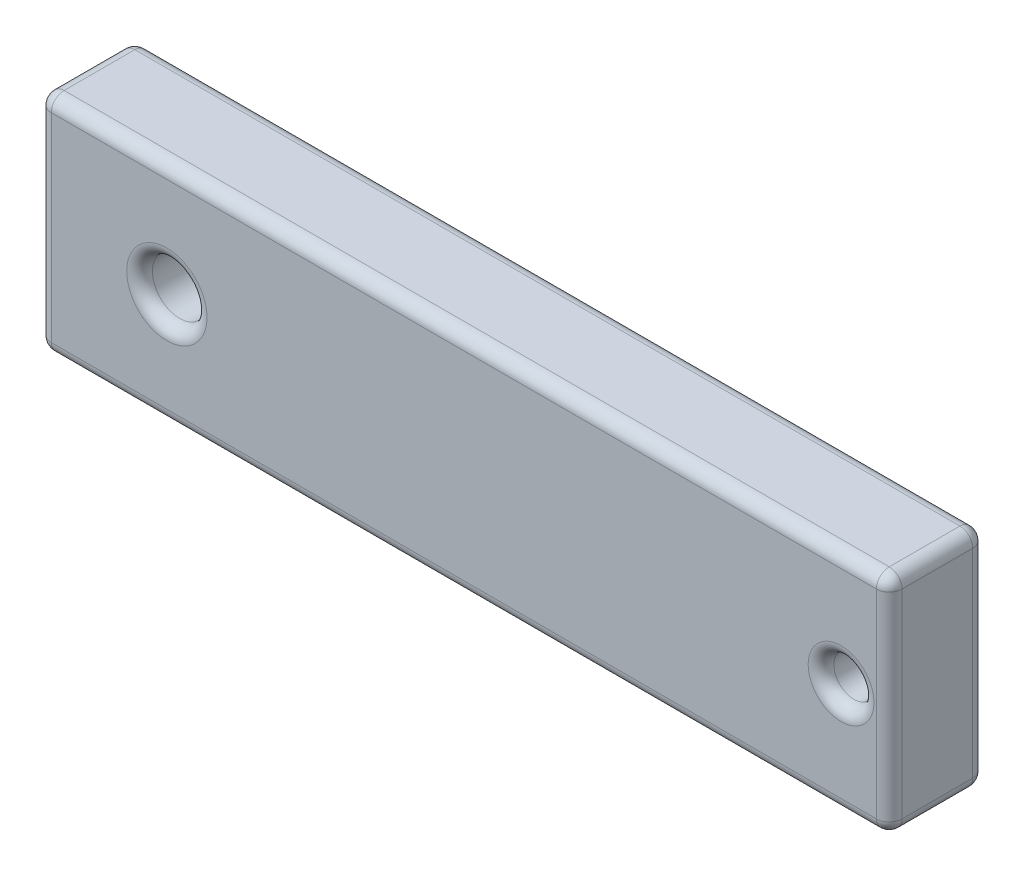
from build123d import *

# Parameters (mm, degrees)
SKETCH_1_W      = 53
SKETCH_1_H      = 14
SKETCH_1_R      = 1.7
SKETCH_1_R_2    = 1.25
EXTRUDE_1_DEPTH = 3
FILLET_1_R      = 0.8


with BuildPart() as part:
    # 草图1 → 凸台-拉伸1 (new, symmetric)
    with BuildSketch(Plane.XY):
        with Locations((18.5, 0)):
            Rectangle(SKETCH_1_W, SKETCH_1_H)
        Circle(SKETCH_1_R, mode=Mode.SUBTRACT)
        with Locations((42, 0)):
            Circle(SKETCH_1_R_2, mode=Mode.SUBTRACT)
    extrude(amount=EXTRUDE_1_DEPTH, both=True)

    # 圆角1
    fillet_1_edges = [part.edges().sort_by_distance(p)[0] for p in [
        (40.75, 0, -3),
        (40.75, 0, 3),
        (-1.7, 0, -3),
        (-1.7, 0, 3),
        (45, 0, -3),
        (18.5, 7, -3),
        (-8, 0, -3),
        (18.5, -7, -3),
        (45, 0, 3),
        (18.5, 7, 3),
        (-8, 0, 3),
        (18.5, -7, 3),
        (45, -7, 0),
        (-8, -7, 0),
        (-8, 7, 0),
        (45, 7, 0),
    ]]
    fillet(fillet_1_edges, radius=FILLET_1_R)


solid = part.part
